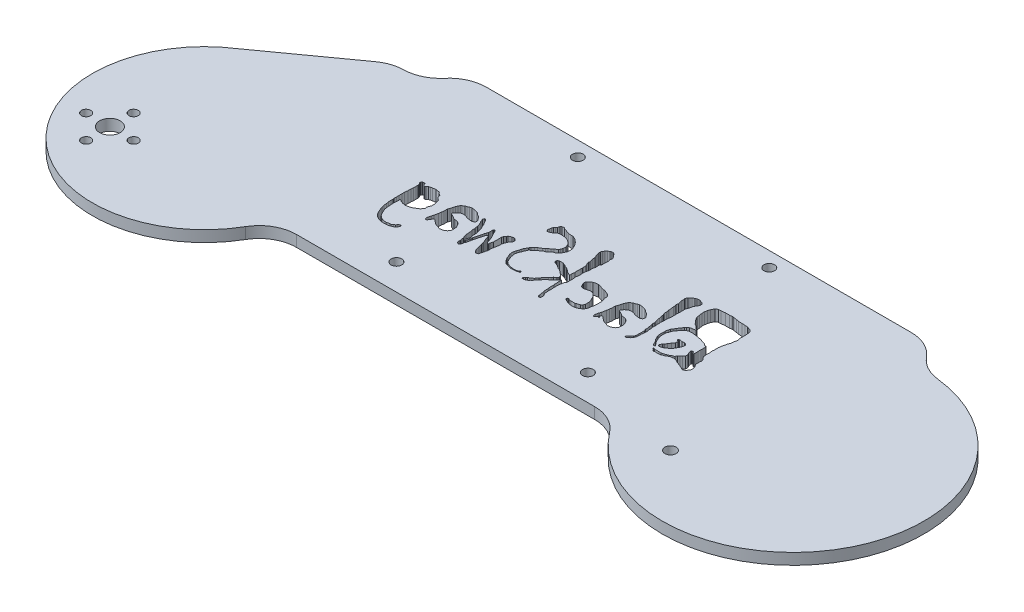
from build123d import *

# Parameters (mm, degrees)
SKETCH1_R           = 2.75
SKETCH1_R_2         = 1.5
BOSS_EXTRUDE1_DEPTH = 3
SKETCH3_R           = 1.42
CUT_EXTRUDE2_DEPTH  = 20
SKETCH5_R           = 1.25
CUT_EXTRUDE3_DEPTH  = 10
FILLET1_R           = 10
FILLET2_R           = 10
FILLET3_R           = 10
CUT_EXTRUDE4_DEPTH  = 10
CUT_EXTRUDE8_DEPTH  = 10
SKETCH12_R          = 0.638544934
SKETCH12_R_2        = 0.500762828
SKETCH12_R_3        = 0.429198386
SKETCH12_R_4        = 0.603558654
SKETCH12_R_5        = 0.236210711
SKETCH12_R_6        = 0.307421129
SKETCH12_R_7        = 0.615950929
BOSS_EXTRUDE2_DEPTH = 3


with BuildPart() as part:
    # Sketch1 → Boss-Extrude1 (new body)
    with BuildSketch(Plane(origin=(0, 0, 0), x_dir=(1, 0, 0), z_dir=(0, 1, 0))):
        with BuildLine():
            Line((-61.421696796, 42.03125), (-67.039661146, 35))
            Line((-67.039661146, 35), (-74.713671979, 35))
            Line((-74.713671979, 35), (-98.746291648, 17.720190477))
            ThreePointArc((-98.746291648, 17.720190477), (-101.110311457, -31.029902411), (-54.215728753, -17.5))
            Line((-54.215728753, -17.5), (37.189110868, -17.5))
            ThreePointArc((37.189110868, -17.5), (97.810889132, -17.5), (67.5, 35))
            Line((67.5, 35), (61.88203565, 42.03125))
            Line((61.88203565, 42.03125), (-61.421696796, 42.03125))
        make_face()
        with Locations(Location((-97.810889132, -17.5, 0), (0, 0, 270))):
            Circle(SKETCH1_R, mode=Mode.SUBTRACT)
        with Locations(Location((52.189110868, -17.5, 0), (0, 0, 270))):
            Circle(SKETCH1_R_2, mode=Mode.SUBTRACT)
    extrude(amount=BOSS_EXTRUDE1_DEPTH)

    # Sketch3 → Cut-Extrude2 (cut)
    with BuildSketch(Plane(origin=(0, 3, 0), x_dir=(1, 0, 0), z_dir=(0, 1, 0))):
        with Locations(Location((-28.142811364, -10.5, 0), (0, 0, 270))):
            Circle(SKETCH3_R)
        with Locations(Location((23.088594579, -10.5, 0), (0, 0, 270))):
            Circle(SKETCH3_R)
        with Locations(Location((-28.142811364, 38.03125, 0), (0, 0, 270))):
            Circle(SKETCH3_R)
        with Locations(Location((23.088594579, 38.03125, 0), (0, 0, 270))):
            Circle(SKETCH3_R)
    extrude(amount=-CUT_EXTRUDE2_DEPTH, mode=Mode.SUBTRACT)

    # Sketch5 → Cut-Extrude3 (cut)
    with BuildSketch(Plane(origin=(0, 3, 0), x_dir=(1, 0, 0), z_dir=(0, 1, 0))):
        with BuildLine():
            ThreePointArc((-97.810889132, -9.9), (-99.060889132, -11.15), (-97.810889132, -12.4))
            Line((-97.810889132, -12.4), (-97.810889132, -9.9))
        make_face()
        with BuildLine():
            Line((-97.810889132, -9.9), (-97.810889132, -12.4))
            ThreePointArc((-97.810889132, -12.4), (-96.927005656, -12.033883476), (-96.560889132, -11.15))
            ThreePointArc((-96.560889132, -11.15), (-96.927005656, -10.266116524), (-97.810889132, -9.9))
        make_face()
        with Locations(Location((-104.160889132, -17.5, 0), (0, 0, 270))):
            Circle(SKETCH5_R)
        with Locations(Location((-91.460889132, -17.5, 0), (0, 0, 270))):
            Circle(SKETCH5_R)
        with Locations(Location((-97.810889132, -23.85, 0), (0, 0, 270))):
            Circle(SKETCH5_R)
    extrude(amount=-CUT_EXTRUDE3_DEPTH, mode=Mode.SUBTRACT)

    # Sketch6 → Loft1 section 0
    with BuildSketch(Plane(origin=(0, 0, 0), x_dir=(-1, 0, 0), z_dir=(0, -1, 0)), mode=Mode.PRIVATE) as loft1_s0:
        with BuildLine():
            Line((-66.122147477, -2.038710992), (-57.305368693, 4.645694205))
            Line((-57.305368693, 4.645694205), (-68.36728736, 4.871119064))
            Line((-68.36728736, 4.871119064), (-72, 15.321968783))
            Line((-72, 15.321968783), (-75.63271264, 4.871119064))
            Line((-75.63271264, 4.871119064), (-86.694631307, 4.645694205))
            Line((-86.694631307, 4.645694205), (-77.877852523, -2.038710992))
            Line((-77.877852523, -2.038710992), (-81.0817816, -12.628880936))
            Line((-81.0817816, -12.628880936), (-72, -6.309220824))
            Line((-72, -6.309220824), (-62.9182184, -12.628880936))
            Line((-62.9182184, -12.628880936), (-66.122147477, -2.038710992))
        make_face()
    loft([Vertex(72, -3, 0), loft1_s0.sketch])

    # Fillet1
    fillet1_edges = [part.edges().sort_by_distance(p)[0] for p in [
        (37.189110868, 1.5, 17.5),
        (-54.215728753, 1.5, 17.5),
    ]]
    fillet(fillet1_edges, radius=FILLET1_R)

    # Fillet2
    fillet2_edges = [part.edges().sort_by_distance(p)[0] for p in [
        (-67.039661146, 1.5, -35),
        (67.5, 1.5, -35),
    ]]
    fillet(fillet2_edges, radius=FILLET2_R)

    # Fillet3
    fillet3_edges = [part.edges().sort_by_distance(p)[0] for p in [
        (61.88203565, 1.5, -42.03125),
        (-61.421696796, 1.5, -42.03125),
        (-74.713671979, 1.5, -35),
    ]]
    fillet(fillet3_edges, radius=FILLET3_R)

    # Sketch8 → Cut-Extrude4 (cut)
    # profile 1 of 20: a face of its own
    with BuildSketch(Plane.XZ):
        Polygon((32.934520943, -22.751623377), (32.95481315, -22.536525974), (33.194261202, -22.5), (33.125267696, -22.751623377), (33.011631332, -23.019480519), align=None)
    # profile 2 of 20: a face of its own
    with BuildSketch(Plane.XZ):
        Polygon((23.843611852, -8.003246753), (23.888254709, -7.459415584), (24.034358605, -7.11038961), (24.298157306, -6.651785714), (24.444261202, -6.205357143), (24.927215748, -5.775162338), (25.146371592, -5.150162338), (25.466988475, -4.63474026), (25.803839125, -4.577922078), (25.92153393, -4.6875), (25.686144319, -4.951298701), (25.657735228, -5.146103896), (25.548157306, -5.284090909), (25.27218328, -5.519480519), (24.846046917, -6.278409091), (24.651241722, -6.789772727), (24.338741722, -7.633928571), (24.363092371, -8.741883117), (24.444261202, -9.391233766), (24.618774189, -9.586038961), (24.643124839, -9.902597403), (24.82981315, -10.18262987), (24.82981315, -10.44237013), (25.27218328, -10.900974026), (25.540040423, -11.371753247), (25.76731315, -11.550324675), (25.820072891, -11.773538961), (26.221858605, -12.146915584), (26.863092371, -12.532467532), (28.040040423, -12.62987013), (29.018124839, -12.508116883), (29.740527436, -12.37012987), (30.527865099, -12.232142857), (32.17153393, -11.672077922), (32.415040423, -11.383928571), (32.800592371, -11.359577922), (32.934520943, -10.921266234), (32.962930034, -10.470779221), (32.934520943, -9.853896104), (32.962930034, -9.103084416), (33.015689774, -8.543019481), (32.962930034, -7.954545455), (32.711306657, -7.954545455), (32.557085878, -8.267045455), (32.415040423, -8.474025974), (32.074131332, -8.380681818), (31.895559904, -8.275162338), (31.919910553, -7.954545455), (32.029488475, -7.516233766), (32.289228735, -7.102272727), (32.374456008, -6.396103896), (31.895559904, -6.010551948), (31.538417047, -5.689935065), (31.221858605, -5.328733766), (31.002702761, -4.837662338), (30.633384579, -4.744318182), (30.207248215, -4.529220779), (29.72429367, -4.200487013), (29.395559904, -4.13961039), (28.941014449, -3.952922078), (28.352540423, -3.798701299), (27.731598865, -3.823051948), (26.607410553, -3.823051948), (26.181274189, -4.070616883), (26.181274189, -3.851461039), (26.303027436, -3.693181818), (26.59929367, -3.486201299), (26.785981982, -3.210227273), (26.96455341, -3.153409091), (27.179650813, -3.279220779), (28.121209254, -3.279220779), (28.835494969, -3.36038961), (28.997832631, -3.547077922), (29.497020943, -3.603896104), (29.910981982, -3.940746753), (30.276241722, -4.050324675), (30.544098865, -4.237012987), (30.787605358, -4.155844156), (31.258384579, -4.318181818), (31.948319644, -4.184253247), (32.780300163, -3.741883117), (33.831436527, -3.392857143), (34.02218328, -3.283279221), (34.789228735, -2.893668831), (35.288417047, -2.75974026), (35.678027436, -3.092532468), (36.177215748, -3.656655844), (36.311144319, -4.387175325), (36.1041638, -5.008116883), (36.15692354, -5.133928571), (35.990527436, -5.271915584), (35.860657306, -5.409902597), (35.552215748, -5.921266234), (35.653676787, -6.404220779), (35.552215748, -6.830357143), (35.678027436, -7.163149351), (35.552215748, -7.8125), (35.304650813, -8.100649351), (34.882572891, -8.612012987), (34.882572891, -9.107142857), (34.805462501, -9.45211039), (34.882572891, -10.418019481), (34.77705341, -10.693993506), (34.752702761, -11.343344156), (34.817637826, -11.635551948), (34.785170293, -12.613636364), (34.943449514, -13.774350649), (35.117962501, -14.200487013), (35.215365099, -14.849837662), (35.434520943, -15.361201299), (35.58468328, -16.546266234), (35.706436527, -16.866883117), (35.682085878, -17.305194805), (35.53192354, -17.625811688), (35.53192354, -19.460227273), (35.446696267, -20.328733766), (35.251891073, -20.70211039), (34.793287176, -21.103896104), (34.253514449, -21.213474026), (33.973481982, -21.37987013), (33.194261202, -21.461038961), (32.427215748, -21.461038961), (31.428839125, -21.50974026), (30.690202761, -21.647727273), (29.979975488, -21.749188312), (29.602540423, -21.858766234), (29.326566397, -21.777597403), (28.811144319, -21.720779221), (27.64231315, -21.720779221), (26.558709254, -21.611201299), (25.901241722, -21.582792208), (25.333059904, -21.209415584), (24.943449514, -20.474837662), (24.760819644, -19.825487013), (24.622832631, -19.147727273), (24.622832631, -18.453733766), (24.764878086, -17.694805195), (24.821696267, -16.935876623), (25.42640406, -15.965909091), (25.860657306, -15.564123377), (26.270559904, -14.967532468), (26.635819644, -14.829545455), (26.98890406, -14.472402597), (27.455624839, -14.123376623), (27.735657306, -13.98538961), (27.682897566, -13.778409091), (27.313579384, -13.668831169), (26.794098865, -13.612012987), (26.315202761, -13.474025974), (25.917475488, -13.068181818), (25.523806657, -12.849025974), (25.251891073, -12.276785714), (24.716176787, -11.566558442), (24.403676787, -10.941558442), (24.103352112, -10.535714286), (23.993774189, -10.105519481), (23.843611852, -9.423701299), (23.884196267, -8.965097403), (23.843611852, -8.518668831), align=None)
        Polygon((25.14231315, -18.080357143), (25.223481982, -18.831168831), (25.280300163, -19.094967532), (25.223481982, -19.338474026), (25.625267696, -19.983766234), (26.148806657, -20.434253247), (26.380137826, -20.434253247), (26.54653393, -20.681818182), (28.072507956, -20.681818182), (28.721858605, -20.519480519), (29.643124839, -20.300324675), (30.576566397, -20.012175325), (31.485657306, -19.655032468), (32.382572891, -19.123376623), (32.723481982, -18.944805195), (33.10903393, -18.591720779), (33.316014449, -18.084415584), (33.454001462, -17.155032468), (33.417475488, -16.623376623), (33.23890406, -15.734577922), (33.202378086, -14.955357143), (33.040040423, -14.55762987), (33.040040423, -13.916396104), (32.934520943, -13.356331169), (32.609845618, -13.218344156), (32.106598865, -13.149350649), (31.526241722, -13.214285714), (30.333059904, -13.563311688), (29.440202761, -13.640422078), (28.936956008, -13.668831169), (28.137443021, -14.038149351), (27.743774189, -14.314123377), (27.366339125, -14.545454545), (26.997020943, -14.943181818), (26.78192354, -15.024350649), (26.526241722, -15.462662338), (26.1041638, -15.779220779), (25.860657306, -16.148538961), (25.466988475, -16.396103896), (25.414228735, -17.012987013), (25.251891073, -17.353896104), (25.276241722, -17.601461039), align=None, mode=Mode.SUBTRACT)
    # profile 3 of 20: a face of its own
    with BuildSketch(Plane.XZ):
        Polygon((26.181274189, -5.458603896), (26.23403393, -5.219155844), (26.493774189, -5.097402597), (26.822507956, -5.097402597), (27.528676787, -5.381493506), (27.991339125, -5.706168831), (28.701566397, -6.132305195), (29.17640406, -6.92775974), (29.557897566, -7.650162338), (29.72429367, -8.116883117), (29.817637826, -8.571428571), (29.817637826, -8.928571429), (29.67153393, -9.099025974), (29.156111852, -9.334415584), (28.563579384, -9.253246753), (27.784358605, -9.362824675), (27.573319644, -9.224837662), (27.479975488, -9.042207792), (27.691014449, -8.843344156), (27.999456008, -8.733766234), (27.942637826, -8.056006494), (27.467800163, -7.467532468), (27.0416638, -6.879058442), (26.712930034, -6.229707792), (26.453189774, -6.107954545), align=None)
    # profile 4 of 20: a face of its own
    with BuildSketch(Plane.XZ):
        Polygon((18.908546917, -19.638798701), (18.997832631, -19.383116883), (18.997832631, -19.0625), (19.026241722, -18.563311688), (19.160170293, -18.120941558), (19.277865099, -17.512175325), (19.160170293, -17.041396104), (19.277865099, -16.627435065), (19.338741722, -16.099837662), (19.456436527, -14.809253247), (19.578189774, -14.419642857), (19.606598865, -13.989448052), (19.578189774, -13.356331169), (19.82981315, -12.909902597), (19.919098865, -12.305194805), (20.065202761, -11.647727273), (20.186956008, -10.921266234), (20.304650813, -10.422077922), (20.491339125, -10.044642857), (20.466988475, -9.760551948), (20.466988475, -9.383116883), (20.604975488, -9.021915584), (20.673968995, -8.551136364), (20.710494969, -8.173701299), (20.811956008, -7.650162338), (20.811956008, -7.203733766), (20.986468995, -6.708603896), (20.986468995, -5.49512987), (20.958059904, -5.105519481), (20.958059904, -4.728084416), (20.901241722, -4.338474026), (20.730787176, -4.030032468), (20.34929367, -3.705357143), (20.154488475, -3.449675325), (19.687767696, -3.019480519), (19.740527436, -2.75974026), (20.016501462, -2.75974026), (20.333059904, -2.893668831), (20.71455341, -3.206168831), (21.071696267, -3.733766234), (21.307085878, -4.176136364), (21.335494969, -4.61038961), (21.359845618, -5.162337662), (21.359845618, -5.580357143), (21.441014449, -6.055194805), (21.505949514, -6.525974026), (21.505949514, -7.053571429), (21.39231315, -7.581168831), (21.372020943, -8.104707792), (21.307085878, -8.482142857), (21.246209254, -8.904220779), (21.28679367, -9.346590909), (21.246209254, -9.845779221), (21.246209254, -10.385551948), (21.165040423, -10.80762987), (21.246209254, -11.25), (21.307085878, -11.806006494), (21.246209254, -12.491883117), (21.396371592, -13.262987013), (21.428839125, -14.017857143), (21.396371592, -14.655032468), (21.457248215, -16.059253247), (21.428839125, -16.63961039), (21.457248215, -17.219967532), (21.623644319, -17.743506494), (21.773806657, -18.299512987), (21.895559904, -18.87987013), (22.139066397, -19.269480519), (22.394748215, -19.63474026), (22.544910553, -20.040584416), (22.544910553, -20.539772727), (22.272994969, -20.852272727), (21.838741722, -21.038961039), (21.404488475, -21.201298701), (21.010819644, -21.201298701), (20.637443021, -21.17288961), (20.199131332, -20.986201299), (19.781111852, -20.649350649), (19.46455341, -20.434253247), (19.164228735, -20.150162338), align=None)
    # profile 5 of 20: a face of its own
    with BuildSketch(Plane.XZ):
        Polygon((18.389066397, -8.153409091), (18.624456008, -7.954545455), (18.908546917, -8.096590909), (18.742150813, -8.474025974), (18.42153393, -8.4375), align=None)
    # profile 6 of 20: a face of its own
    with BuildSketch(Plane.XZ):
        Polygon((10.580624839, -6.116071429), (10.747020943, -6.006493506), (10.89718328, -6.063311688), (10.89718328, -6.225649351), (10.637443021, -6.347402597), align=None)
    # profile 7 of 20: a face of its own
    with BuildSketch(Plane.XZ):
        Polygon((10.596858605, -3.668831169), (10.625267696, -3.482142857), (10.824131332, -3.279220779), (11.035170293, -3.279220779), (11.262443021, -3.498376623), (11.376079384, -3.831168831), (11.607410553, -4.103084416), (11.753514449, -4.476461039), (11.895559904, -4.577922078), (12.049780683, -4.500811688), (12.264878086, -4.362824675), (12.496209254, -4.082792208), (12.865527436, -3.867694805), (13.092800163, -3.640422078), (13.490527436, -3.4375), (13.936956008, -3.271103896), (14.318449514, -3.145292208), (14.663417047, -3.043831169), (14.919098865, -2.938311688), (15.186956008, -3.019480519), (15.556274189, -3.07224026), (15.990527436, -3.258928571), (16.384196267, -3.51461039), (16.627702761, -3.839285714), (16.806274189, -4.200487013), (16.830624839, -4.776785714), (16.830624839, -5.166396104), (16.753514449, -5.592532468), (16.518124839, -6.034902597), (16.290852112, -6.452922078), (15.978352112, -6.749188312), (15.653676787, -7.000811688), (15.215365099, -7.081980519), (14.825754709, -7.13474026), (14.387443021, -7.244318182), (14.010007956, -7.5), (13.522994969, -7.767857143), (13.283546917, -7.873376623), (13.035981982, -7.954545455), (12.934520943, -8.210227273), (13.145559904, -8.56737013), (13.393124839, -8.887987013), (13.9166638, -9.342532468), (14.452378086, -9.488636364), (14.882572891, -9.512987013), (15.040852112, -9.488636364), (15.316826138, -9.488636364), (15.641501462, -9.334415584), (15.929650813, -9.159902597), (16.282735228, -9.107142857), (16.67640406, -9.107142857), (17.135007956, -8.993506494), (17.540852112, -8.993506494), (17.869585878, -9.172077922), (18.104975488, -9.419642857), (18.129326138, -9.76461039), (18.048157306, -10.068993506), (17.760007956, -10.413961039), (17.455624839, -10.815746753), (17.086306657, -11.116071429), (16.672345618, -11.339285714), (16.221858605, -11.708603896), (15.795722241, -11.903409091), (15.012443021, -12.053571429), (14.342800163, -12.11038961), (13.859845618, -11.976461039), (13.462118345, -11.773538961), (13.035981982, -11.63961039), (12.557085878, -11.331168831), (12.309520943, -11.091720779), (12.061956008, -10.70211039), (11.883384579, -10.202922078), (11.745397566, -9.719967532), (11.554650813, -9.078733766), (11.376079384, -8.595779221), (11.351728735, -8.17775974), (11.376079384, -7.654220779), (11.254326138, -7.049512987), (11.185332631, -6.420454545), (10.970235228, -5.320616883), (10.836306657, -4.902597403), (10.718611852, -4.529220779), (10.621209254, -4.058441558), align=None)
        Polygon((12.646371592, -6.651785714), (12.747832631, -6.810064935), (13.096858605, -6.915584416), (13.393124839, -6.887175325), (13.660981982, -6.757305195), (13.961306657, -6.651785714), (14.269748215, -6.465097403), (14.570072891, -6.412337662), (14.833871592, -6.266233766), (15.065202761, -6.079545455), (15.207248215, -5.844155844), (15.389878086, -5.535714286), (15.434520943, -5.271915584), (15.53192354, -5.020292208), (15.53192354, -4.703733766), (15.410170293, -4.423701299), (15.08955341, -4.318181818), (14.740527436, -4.318181818), (14.354975488, -4.423701299), (14.17640406, -4.63474026), (13.936956008, -4.703733766), (13.372832631, -5.125811688), (13.096858605, -5.324675325), (12.90205341, -5.669642857), (12.699131332, -5.949675325), (12.674780683, -6.318993506), align=None, mode=Mode.SUBTRACT)
    # profile 8 of 20: a face of its own
    with BuildSketch(Plane.XZ):
        Polygon((11.635819644, -3.762175325), (11.716988475, -3.676948052), (11.895559904, -3.762175325), (11.842800163, -3.924512987), (11.716988475, -4.021915584), align=None)
    # profile 9 of 20: a face of its own
    with BuildSketch(Plane.XZ):
        Polygon((1.765689774, -9.845779221), (1.818449514, -9.460227273), (1.952378086, -9.176136364), (2.317637826, -8.51461039), (2.691014449, -8.392857143), (3.21455341, -8.392857143), (3.65692354, -8.543019481), (4.005949514, -8.595779221), (4.476728735, -8.733766234), (4.894748215, -8.733766234), (5.174780683, -8.628246753), (5.657735228, -8.356331169), (5.941826138, -8.068181818), (6.23403393, -7.690746753), (6.436956008, -7.313311688), (6.542475488, -7.000811688), (6.623644319, -6.781655844), (6.814391073, -6.623376623), (6.932085878, -6.091720779), (6.960494969, -5.698051948), (6.960494969, -4.943181818), (6.785981982, -4.541396104), (6.432897566, -4.200487013), (6.124456008, -4.070616883), (5.653676787, -3.928571429), (5.357410553, -3.798701299), (4.330624839, -3.798701299), (3.888254709, -3.859577922), (3.644748215, -3.944805195), (3.454001462, -4.058441558), (3.198319644, -4.030032468), (3.064391073, -3.798701299), (3.117150813, -3.607954545), (3.389066397, -3.388798701), (3.758384579, -3.210227273), (4.233222241, -3.019480519), (4.655300163, -2.881493506), (5.008384579, -2.828733766), (5.702378086, -2.75974026), (6.355787176, -2.828733766), (6.737280683, -2.991071429), (7.102540423, -3.153409091), (7.48403393, -3.413149351), (7.77218328, -3.518668831), (7.934520943, -3.900162338), (8.10903393, -4.241071429), (8.218611852, -4.63474026), (8.275430034, -5.137987013), (8.409358605, -5.693993506), (8.490527436, -6.306818182), (8.490527436, -6.741071429), (8.518936527, -7.325487013), (8.490527436, -7.771915584), (8.409358605, -8.246753247), (8.222670293, -8.640422078), (8.141501462, -8.912337662), (8.141501462, -9.443993506), (8.019748215, -9.837662338), (7.492150813, -10.300324675), (7.248644319, -10.422077922), (7.057897566, -10.474837662), (6.554650813, -10.665584416), (6.217800163, -10.775162338), (5.92153393, -10.799512987), (5.418287176, -10.925324675), (4.919098865, -11.112012987), (4.525430034, -11.221590909), (4.119585878, -11.331168831), (3.729975488, -11.30275974), (3.279488475, -11.217532468), (2.861468995, -11.075487013), (2.455624839, -10.746753247), (2.118774189, -10.519480519), (1.846858605, -10.219155844), align=None)
    # profile 10 of 20: a face of its own
    with BuildSketch(Plane.XZ):
        Polygon((8.778676787, -8.69724026), (8.945072891, -8.474025974), (9.115527436, -8.607954545), (9.298157306, -8.786525974), (9.079001462, -8.993506494), (8.778676787, -8.993506494), align=None)
    # profile 11 of 20: a face of its own
    with BuildSketch(Plane.XZ):
        Polygon((-7.584959577, -2.73538961), (-7.528141395, -2.528409091), (-7.325219317, -2.5), (-6.964018018, -2.5), (-6.566290746, -2.666396104), (-6.140154382, -2.897727273), (-6.03057646, -3.145292208), (-5.685608927, -3.405032468), (-5.409634901, -3.790584416), (-5.036258278, -4.131493506), (-4.524894642, -4.862012987), (-4.330089447, -5.202922078), (-3.997297239, -5.478896104), (-3.599569966, -5.767045455), (-3.278953083, -6.043019481), (-2.921810226, -6.274350649), (-2.353628408, -6.810064935), (-1.870673862, -7.333603896), (-1.801680356, -5.511363636), (-1.757037499, -5.166396104), (-1.757037499, -3.93262987), (-1.683985551, -3.559253247), (-1.627167369, -2.654220779), (-1.558173862, -2.244318182), (-1.351193343, -1.164772727), (-1.318725811, -0.80762987), (-1.168563473, -0.474837662), (-0.876355681, -0.422077922), (-0.632849187, -0.474837662), (-0.571972564, -0.762987013), (-0.571972564, -1.237824675), (-0.896647888, -1.826298701), (-1.058985551, -2.329545455), (-1.058985551, -2.792207792), (-1.132037499, -3.352272727), (-1.091453083, -3.855519481), (-1.132037499, -4.521103896), (-1.132037499, -5.284090909), (-1.091453083, -6.034902597), (-0.961582953, -6.948051948), (-0.636907629, -7.573051948), (-0.604440096, -8.214285714), (-0.604440096, -8.993506494), (-0.636907629, -9.496753247), (-0.701842694, -9.971590909), (-0.571972564, -10.478896104), (-0.571972564, -11.063311688), (-0.600381655, -11.704545455), (-0.628790746, -11.976461039), (-0.600381655, -12.508116883), (-0.429927109, -12.958603896), (-0.397459577, -13.461850649), (-0.397459577, -14.293831169), (-0.210771265, -14.931006494), (-0.304115421, -15.775162338), (0.028676787, -16.241883117), (0.004326138, -16.976461039), (0.004326138, -17.451298701), (0.057085878, -17.918019481), (-0.052492044, -18.555194805), (0.028676787, -19.11525974), (-0.133660875, -19.508928571), (-0.413693343, -19.825487013), (-0.681550486, -20.178571429), (-0.989992044, -20.543831169), (-1.363368668, -20.681818182), (-1.777329707, -20.600649351), (-2.04518685, -20.462662338), (-2.434797239, -20.227272727), (-2.767589447, -19.894480519), (-3.007037499, -19.492694805), (-3.14096607, -19.163961039), (-3.169375161, -18.790584416), (-3.043563473, -18.388798701), (-2.946160875, -18.003246753), (-2.795998538, -17.491883117), (-2.580901135, -17.033279221), (-2.556550486, -16.550324675), (-2.430738798, -16.124188312), (-2.308985551, -15.499188312), (-2.35768685, -15.056818182), (-2.183173862, -14.492694805), (-1.895024512, -14.00974026), (-1.895024512, -13.303571429), (-1.842264772, -13.039772727), (-1.870673862, -12.613636364), (-1.870673862, -11.205357143), (-1.842264772, -10.803571429), (-1.927492044, -10.154220779), (-1.870673862, -9.50487013), (-2.90557646, -10.068993506), (-3.299245291, -10.466720779), (-3.591453083, -10.576298701), (-3.871485551, -10.795454545), (-4.630414122, -11.112012987), (-4.882037499, -11.331168831), (-5.162069966, -11.359577922), (-5.454277759, -11.50974026), (-5.803303733, -11.5625), (-6.196972564, -11.590909091), (-6.517589447, -11.558441558), (-6.797621914, -11.424512987), (-7.008660875, -11.176948052), (-7.065479057, -10.965909091), (-6.935608927, -10.706168831), (-6.736745291, -10.551948052), (-6.326842694, -10.418019481), (-5.925056979, -10.227272727), (-5.543563473, -10.05275974), (-5.283823213, -9.809253247), (-4.902329707, -9.577922078), (-4.618238798, -9.553571429), (-4.317914122, -9.310064935), (-3.932362174, -9.066558442), (-3.563043992, -8.754058442), (-3.149082953, -8.388798701), (-2.950219317, -8.120941558), (-2.836582953, -7.901785714), (-2.836582953, -7.674512987), (-3.027329707, -7.402597403), (-3.214018018, -7.252435065), (-3.60768685, -6.956168831), (-3.879602434, -6.566558442), (-4.244862174, -6.241883117), (-5.137719317, -5.186688312), (-5.32846607, -4.821428571), (-5.693725811, -4.443993506), (-5.961582953, -4.078733766), (-6.274082953, -3.916396104), (-6.639342694, -3.628246753), (-7.0208362, -3.433441558), (-7.20346607, -3.145292208), (-7.479440096, -2.897727273), align=None)
    # profile 12 of 20: a face of its own
    with BuildSketch(Plane.XZ):
        Polygon((-15.377167369, -16.408279221), (-15.344699837, -16.06737013), (-14.934797239, -15.978084416), (-14.658823213, -16.006493506), (-14.33820633, -16.286525974), (-14.630414122, -16.525974026), (-15.072784252, -16.554383117), align=None)
    # profile 13 of 20: a face of its own
    with BuildSketch(Plane.XZ):
        Polygon((-15.377167369, -17.122564935), (-15.121485551, -16.785714286), (-14.776518018, -16.785714286), (-14.362556979, -16.935876623), (-13.97294659, -17.126623377), (-13.575219317, -17.426948052), (-13.494050486, -17.686688312), (-12.998920616, -17.796266234), (-12.718888148, -17.905844156), (-12.170998538, -17.824675325), (-11.704277759, -17.824675325), (-11.221323213, -17.796266234), (-10.555738798, -17.548701299), (-10.072784252, -17.260551948), (-9.297621914, -16.530032468), (-9.139342694, -16.132305195), (-8.883660875, -15.568181818), (-8.94859594, -14.92288961), (-9.163693343, -14.383116883), (-9.374732304, -14.054383117), (-10.068725811, -13.543019481), (-10.466453083, -13.20211039), (-10.933173862, -12.897727273), (-11.29031672, -12.55275974), (-11.716453083, -12.224025974), (-12.597134901, -11.688311688), (-13.03544659, -11.286525974), (-13.356063473, -10.917207792), (-13.66044659, -10.698051948), (-13.741615421, -10.381493506), (-14.179927109, -9.650974026), (-14.366615421, -9.196428571), (-14.472134901, -8.701298701), (-14.670998538, -8.165584416), (-14.829277759, -7.654220779), (-14.85768685, -6.92775974), (-14.752167369, -6.363636364), (-14.443725811, -5.70211039), (-14.28544659, -5.178571429), (-13.94859594, -4.805194805), (-13.79031672, -4.464285714), (-13.40070633, -4.050324675), (-13.055738798, -3.762175325), (-12.479440096, -3.538961039), (-11.7083362, -3.405032468), (-11.172621914, -3.279220779), (-10.559797239, -3.372564935), (-10.129602434, -3.396915584), (-9.744050486, -3.457792208), (-9.451842694, -3.583603896), (-9.248920616, -3.583603896), (-9.143401135, -3.689123377), (-9.196160875, -3.93262987), (-9.301680356, -4.058441558), (-9.496485551, -4.058441558), (-9.496485551, -3.920454545), (-9.54518685, -3.82711039), (-9.72781672, -3.725649351), (-10.105251785, -3.583603896), (-10.95346607, -3.538961039), (-11.225381655, -3.62012987), (-11.643401135, -3.595779221), (-12.20346607, -3.762175325), (-12.710771265, -3.997564935), (-13.335771265, -4.45211039), (-13.441290746, -4.784902597), (-13.701031005, -5.239448052), (-13.855251785, -5.726461039), (-14.054115421, -6.083603896), (-14.07846607, -6.513798701), (-14.216453083, -7.138798701), (-14.106875161, -7.540584416), (-13.997297239, -8.080357143), (-13.721323213, -8.494318182), (-13.591453083, -9.005681818), (-13.352005031, -9.488636364), (-13.181550486, -9.94724026), (-12.864992044, -10.142045455), (-12.613368668, -10.430194805), (-12.244050486, -10.710227273), (-11.91531672, -11.055194805), (-11.318725811, -11.331168831), (-10.965641395, -11.704545455), (-10.567914122, -11.789772727), (-10.186420616, -12.13474026), (-9.695349187, -12.491883117), (-9.431550486, -12.727272727), (-8.944537499, -12.869318182), (-8.481875161, -13.295454545), (-8.071972564, -13.794642857), (-7.836582953, -14.306006494), (-7.584959577, -14.845779221), (-7.584959577, -15.925324675), (-7.812232304, -16.521915584), (-8.084147888, -17.090097403), (-8.392589447, -17.573051948), (-8.745673862, -17.962662338), (-9.082524512, -18.279220779), (-9.500543992, -18.624188312), (-9.995673862, -18.875811688), (-10.429927109, -19.042207792), (-11.063043992, -19.066558442), (-11.667751785, -19.123376623), (-12.276518018, -19.269480519), (-12.800056979, -19.541396104), (-13.352005031, -19.699675325), (-13.60768685, -19.902597403), (-14.135284252, -19.821428571), (-14.431550486, -19.541396104), (-14.606063473, -19.042207792), (-14.825219317, -18.774350649), (-15.09307646, -18.49025974), (-15.267589447, -18.060064935), (-15.324407629, -17.646103896), align=None)
    # profile 14 of 20: a face of its own
    with BuildSketch(Plane.XZ):
        Polygon((-24.72781672, -10.231331169), (-24.634472564, -10.101461039), (-24.46807646, -10.206980519), (-24.46807646, -10.308441558), (-24.634472564, -10.361201299), align=None)
    # profile 15 of 20: a face of its own
    with BuildSketch(Plane.XZ):
        Polygon((-26.545998538, -10.957792208), (-26.464829707, -10.734577922), (-26.355251785, -10.515422078), (-26.221323213, -10.113636364), (-25.961582953, -9.797077922), (-25.852005031, -9.521103896), (-25.71807646, -9.090909091), (-25.555738798, -8.607954545), (-25.527329707, -8.137175325), (-25.40557646, -7.73538961), (-25.40557646, -7.305194805), (-25.377167369, -7.05762987), (-25.295998538, -6.712662338), (-25.243238798, -6.282467532), (-25.186420616, -5.75487013), (-25.162069966, -5.300324675), (-25.105251785, -4.898538961), (-24.942914122, -4.468344156), (-24.739992044, -4.082792208), (-24.711582953, -3.709415584), (-24.711582953, -3.376623377), (-24.602005031, -3.003246753), (-24.602005031, -2.601461039), (-24.549245291, -2.353896104), (-24.46807646, -2.118506494), (-24.114992044, -1.980519481), (-23.871485551, -1.980519481), (-23.688855681, -2.215909091), (-23.595511525, -2.658279221), (-23.567102434, -3.003246753), (-23.380414122, -3.198051948), (-23.356063473, -3.433441558), (-23.274894642, -3.737824675), (-23.14096607, -4.306006494), (-23.08820633, -4.679383117), (-23.023271265, -4.955357143), (-22.942102434, -5.271915584), (-22.860933603, -5.604707792), (-22.783823213, -5.840097403), (-22.783823213, -6.116071429), (-22.649894642, -6.351461039), (-22.568725811, -6.574675325), (-22.451031005, -6.976461039), (-22.422621914, -7.252435065), (-22.317102434, -7.516233766), (-22.154764772, -7.763798701), (-21.996485551, -7.901785714), (-21.813855681, -7.739448052), (-21.728628408, -7.455357143), (-21.614992044, -7.155032468), (-21.586582953, -6.899350649), (-21.529764772, -6.708603896), (-21.359310226, -6.493506494), (-21.205089447, -6.099837662), (-21.063043992, -5.775162338), (-20.920998538, -5.381493506), (-20.892589447, -4.987824675), (-20.750543992, -4.638798701), (-20.653141395, -4.24512987), (-20.539505031, -3.823051948), (-20.454277759, -3.376623377), (-20.312232304, -3.051948052), (-20.194537499, -2.686688312), (-20.007849187, -2.443181818), (-19.715641395, -2.24025974), (-19.541128408, -2.211850649), (-19.293563473, -2.211850649), (-19.090641395, -2.333603896), (-19.058173862, -2.524350649), (-18.944537499, -2.820616883), (-18.855251785, -3.153409091), (-18.753790746, -3.465909091), (-18.696972564, -3.948863636), (-18.558985551, -4.232954545), (-18.558985551, -4.529220779), (-18.53057646, -4.943181818), (-18.53057646, -5.308441558), (-18.473758278, -5.657467532), (-18.331712824, -6.465097403), (-18.234310226, -6.814123377), (-18.205901135, -7.179383117), (-18.234310226, -7.516233766), (-18.173433603, -7.918019481), (-18.084147888, -8.283279221), (-17.933985551, -8.551136364), (-17.844699837, -8.859577922), (-17.72294659, -9.103084416), (-17.528141395, -9.249188312), (-17.317102434, -9.464285714), (-17.195349187, -9.736201299), (-17.195349187, -10.206980519), (-17.406388148, -10.487012987), (-17.589018018, -10.67775974), (-17.994862174, -10.811688312), (-18.465641395, -10.758928571), (-18.855251785, -10.568181818), (-19.143401135, -10.405844156), (-19.386907629, -10.150162338), (-19.476193343, -9.935064935), (-19.670998538, -9.675324675), (-19.792751785, -9.326298701), (-19.792751785, -8.93262987), (-19.792751785, -8.543019481), (-19.792751785, -8.084415584), (-19.792751785, -7.637987013), (-19.792751785, -7.11038961), (-19.877979057, -6.801948052), (-19.967264772, -6.530032468), (-20.052492044, -6.221590909), (-20.052492044, -5.978084416), (-20.036258278, -5.868506494), (-20.218888148, -5.949675325), (-20.389342694, -6.063311688), (-20.531388148, -6.351461039), (-20.616615421, -6.655844156), (-20.742427109, -7.029220779), (-21.054927109, -7.844967532), (-21.282199837, -8.275162338), (-21.493238798, -8.579545455), (-21.720511525, -9.00974026), (-21.89096607, -9.411525974), (-21.988368668, -9.659090909), (-22.130414122, -9.894480519), (-22.231875161, -10.032467532), (-22.524082953, -10.004058442), (-22.649894642, -9.797077922), (-22.649894642, -9.521103896), (-22.621485551, -9.204545455), (-22.621485551, -8.924512987), (-22.649894642, -8.579545455), (-22.763531005, -8.275162338), (-22.929927109, -7.849025974), (-22.986745291, -7.418831169), (-23.14096607, -6.976461039), (-23.250543992, -6.436688312), (-23.364180356, -5.978084416), (-23.473758278, -5.551948052), (-23.587394642, -5.275974026), (-23.587394642, -4.926948052), (-23.684797239, -4.569805195), (-23.741615421, -4.249188312), (-23.826842694, -4.001623377), (-23.879602434, -3.709415584), (-23.993238798, -3.628246753), (-24.147459577, -3.875811688), (-24.147459577, -4.13961039), (-24.094699837, -4.443993506), (-23.936420616, -4.760551948), (-23.908011525, -5.064935065), (-23.936420616, -5.385551948), (-24.045998538, -5.840097403), (-24.070349187, -6.201298701), (-24.070349187, -6.603084416), (-24.094699837, -7.029220779), (-24.200219317, -7.443181818), (-24.39096607, -7.844967532), (-24.46807646, -8.275162338), (-24.5208362, -8.607954545), (-24.699407629, -8.924512987), (-24.869862174, -9.200487013), (-25.048433603, -9.602272727), (-25.202654382, -9.975649351), (-25.397459577, -10.223214286), (-25.600381655, -10.543831169), (-25.705901135, -10.819805195), (-25.896647888, -11.055194805), (-26.026518018, -11.331168831), (-26.347134901, -11.359577922), (-26.387719317, -11.25), align=None)
    # profile 16 of 20: a face of its own
    with BuildSketch(Plane.XZ):
        Polygon((-34.354440096, -6.116071429), (-34.188043992, -6.006493506), (-34.037881655, -6.063311688), (-34.037881655, -6.225649351), (-34.297621914, -6.347402597), align=None)
    # profile 17 of 20: a face of its own
    with BuildSketch(Plane.XZ):
        Polygon((-34.33820633, -3.668831169), (-34.309797239, -3.482142857), (-34.110933603, -3.279220779), (-33.899894642, -3.279220779), (-33.672621914, -3.498376623), (-33.558985551, -3.831168831), (-33.327654382, -4.103084416), (-33.181550486, -4.476461039), (-33.039505031, -4.577922078), (-32.885284252, -4.500811688), (-32.67018685, -4.362824675), (-32.438855681, -4.082792208), (-32.069537499, -3.867694805), (-31.842264772, -3.640422078), (-31.444537499, -3.4375), (-30.998108927, -3.271103896), (-30.616615421, -3.145292208), (-30.271647888, -3.043831169), (-30.01596607, -2.938311688), (-29.748108927, -3.019480519), (-29.378790746, -3.07224026), (-28.944537499, -3.258928571), (-28.550868668, -3.51461039), (-28.307362174, -3.839285714), (-28.128790746, -4.200487013), (-28.104440096, -4.776785714), (-28.104440096, -5.166396104), (-28.181550486, -5.592532468), (-28.416940096, -6.034902597), (-28.644212824, -6.452922078), (-28.956712824, -6.749188312), (-29.281388148, -7.000811688), (-29.719699837, -7.081980519), (-30.109310226, -7.13474026), (-30.547621914, -7.244318182), (-30.925056979, -7.5), (-31.412069966, -7.767857143), (-31.651518018, -7.873376623), (-31.899082953, -7.954545455), (-32.000543992, -8.210227273), (-31.789505031, -8.56737013), (-31.541940096, -8.887987013), (-31.018401135, -9.342532468), (-30.48268685, -9.488636364), (-30.052492044, -9.512987013), (-29.894212824, -9.488636364), (-29.618238798, -9.488636364), (-29.293563473, -9.334415584), (-29.005414122, -9.159902597), (-28.652329707, -9.107142857), (-28.258660875, -9.107142857), (-27.800056979, -8.993506494), (-27.394212824, -8.993506494), (-27.065479057, -9.172077922), (-26.830089447, -9.419642857), (-26.805738798, -9.76461039), (-26.886907629, -10.068993506), (-27.175056979, -10.413961039), (-27.479440096, -10.815746753), (-27.848758278, -11.116071429), (-28.262719317, -11.339285714), (-28.71320633, -11.708603896), (-29.139342694, -11.903409091), (-29.922621914, -12.053571429), (-30.592264772, -12.11038961), (-31.075219317, -11.976461039), (-31.47294659, -11.773538961), (-31.899082953, -11.63961039), (-32.377979057, -11.331168831), (-32.625543992, -11.091720779), (-32.873108927, -10.70211039), (-33.051680356, -10.202922078), (-33.189667369, -9.719967532), (-33.380414122, -9.078733766), (-33.558985551, -8.595779221), (-33.5833362, -8.17775974), (-33.558985551, -7.654220779), (-33.680738798, -7.049512987), (-33.749732304, -6.420454545), (-33.964829707, -5.320616883), (-34.098758278, -4.902597403), (-34.216453083, -4.529220779), (-34.313855681, -4.058441558), align=None)
        Polygon((-32.288693343, -6.651785714), (-32.187232304, -6.810064935), (-31.83820633, -6.915584416), (-31.541940096, -6.887175325), (-31.274082953, -6.757305195), (-30.973758278, -6.651785714), (-30.66531672, -6.465097403), (-30.364992044, -6.412337662), (-30.101193343, -6.266233766), (-29.869862174, -6.079545455), (-29.72781672, -5.844155844), (-29.54518685, -5.535714286), (-29.500543992, -5.271915584), (-29.403141395, -5.020292208), (-29.403141395, -4.703733766), (-29.524894642, -4.423701299), (-29.845511525, -4.318181818), (-30.194537499, -4.318181818), (-30.580089447, -4.423701299), (-30.758660875, -4.63474026), (-30.998108927, -4.703733766), (-31.562232304, -5.125811688), (-31.83820633, -5.324675325), (-32.033011525, -5.669642857), (-32.235933603, -5.949675325), (-32.260284252, -6.318993506), align=None, mode=Mode.SUBTRACT)
    # profile 18 of 20: a face of its own
    with BuildSketch(Plane.XZ):
        Polygon((-33.299245291, -3.762175325), (-33.21807646, -3.676948052), (-33.039505031, -3.762175325), (-33.092264772, -3.924512987), (-33.21807646, -4.021915584), align=None)
    # profile 19 of 20: a face of its own
    with BuildSketch(Plane.XZ):
        Polygon((-43.429115421, -11.034902597), (-43.278953083, -10.775162338), (-43.116615421, -10.556006494), (-43.007037499, -10.162337662), (-43.03544659, -9.602272727), (-43.03544659, -8.993506494), (-43.116615421, -8.352272727), (-43.116615421, -7.520292208), (-43.222134901, -6.732954545), (-43.169375161, -6.038961039), (-43.222134901, -5.23538961), (-43.169375161, -4.598214286), (-43.226193343, -3.969155844), (-43.116615421, -3.587662338), (-43.169375161, -3.084415584), (-43.116615421, -2.390422078), (-43.031388148, -1.781655844), (-42.978628408, -1.018668831), (-42.840641395, -0.515422078), (-42.690479057, -0.05275974), (-42.442914122, 0.588474026), (-42.130414122, 1.323051948), (-41.830089447, 1.854707792), (-41.21320633, 2.467532468), (-40.843888148, 2.739448052), (-40.259472564, 2.970779221), (-39.670998538, 3.161525974), (-38.891777759, 3.214285714), (-38.193725811, 3.161525974), (-37.605251785, 3.112824675), (-37.07359594, 2.893668831), (-36.647459577, 2.73538961), (-36.278141395, 2.414772727), (-36.034634901, 2.130681818), (-35.896647888, 1.757305195), (-35.896647888, 1.448863636), (-36.172621914, 1.396103896), (-36.416128408, 1.521915584), (-36.619050486, 1.696428571), (-36.858498538, 2.008928571), (-37.195349187, 2.207792208), (-37.568725811, 2.471590909), (-38.039505031, 2.520292208), (-38.696972564, 2.694805195), (-39.395024512, 2.613636364), (-39.971323213, 2.475649351), (-40.401518018, 2.24025974), (-40.868238798, 1.854707792), (-41.176680356, 1.400162338), (-41.501355681, 0.864448052), (-41.700219317, 0.353084416), (-41.96807646, -0.267857143), (-42.049245291, -0.913149351), (-42.130414122, -1.700487013), (-42.183173862, -2.471590909), (-42.183173862, -2.978896104), (-42.130414122, -3.474025974), (-42.102005031, -3.818993506), (-42.130414122, -4.577922078), (-41.558173862, -4.163961039), (-40.872297239, -3.924512987), (-40.076842694, -3.798701299), (-39.447784252, -3.904220779), (-38.79031672, -4.082792208), (-38.108498538, -4.456168831), (-37.702654382, -4.74025974), (-37.239992044, -4.979707792), (-36.959959577, -5.426136364), (-36.696160875, -5.840097403), (-36.781388148, -6.339285714), (-36.639342694, -6.631493506), (-36.416128408, -7.211850649), (-36.416128408, -7.398538961), (-36.444537499, -8.230519481), (-36.639342694, -8.916396104), (-36.809797239, -9.415584416), (-37.300868668, -9.776785714), (-37.625543992, -10.178571429), (-37.706712824, -10.706168831), (-38.116615421, -10.957792208), (-38.368238798, -11.12012987), (-38.534634901, -11.387987013), (-39.687232304, -11.590909091), (-40.429927109, -11.465097403), (-40.896647888, -11.383928571), (-41.302492044, -11.225649351), (-41.582524512, -11.002435065), (-41.850381655, -10.811688312), (-42.130414122, -10.848214286), (-42.38609594, -11.152597403), (-42.491615421, -11.497564935), (-42.85281672, -11.590909091), (-43.173433603, -11.497564935), (-43.364180356, -11.278409091), align=None)
        Polygon((-42.130414122, -5.791396104), (-42.04518685, -6.217532468), (-42.04518685, -6.680194805), (-42.07359594, -7.171266234), (-42.016777759, -8.125), (-41.927492044, -8.664772727), (-41.78544659, -9.001623377), (-41.481063473, -9.253246753), (-41.10768685, -9.176136364), (-40.685608927, -8.956980519), (-40.267589447, -8.725649351), (-39.821160875, -8.348214286), (-39.200219317, -8.116883117), (-38.494050486, -7.13474026), (-38.465641395, -6.607142857), (-38.384472564, -6.181006494), (-38.579277759, -5.819805195), (-38.940479057, -5.519480519), (-39.330089447, -5.016233766), (-40.007849187, -4.679383117), (-40.543563473, -4.577922078), (-41.221323213, -4.630681818), (-41.899082953, -4.837662338), (-42.07359594, -5.300324675), align=None, mode=Mode.SUBTRACT)
    # profile 20 of 20: a face of its own
    with BuildSketch(Plane.XZ):
        Polygon((-38.002979057, -2.857142857), (-37.974569966, -2.637987013), (-37.771647888, -2.5), (-37.373920616, -2.5), (-37.195349187, -2.743506494), (-37.564667369, -2.857142857), (-37.771647888, -3.019480519), align=None)
    extrude(amount=-CUT_EXTRUDE4_DEPTH, mode=Mode.SUBTRACT)


with BuildPart() as cut_extrude4_piece_1:
    # of the separate pieces the step leaves, piece 1, a body of its own (cut_extrude4_pieces)
    add(part.part.solids().sort_by_distance((64.805019755, 0, -38.37429318))[0])

    # Sketch12 → Boss-Extrude2 (add)
    with BuildSketch(Plane(origin=(0, 0, 0), x_dir=(-1, 0, 0), z_dir=(0, -1, 0))):
        with Locations((-33.125267696, 22.751623377)):
            Circle(SKETCH12_R)
        with Locations((-18.628541849, 8.20687332)):
            Circle(SKETCH12_R_2)
        with Locations((-10.60903393, 6.231737013)):
            Circle(SKETCH12_R_3)
        with Locations((-8.96919948, 8.71261769)):
            Circle(SKETCH12_R_4)
        with Locations((33.159501198, 3.79308281)):
            Circle(SKETCH12_R_5)
        with Locations((34.245622619, 6.044411139)):
            Circle(SKETCH12_R_6)
        with Locations((37.575704284, 2.764464079)):
            Circle(SKETCH12_R_7)
        Polygon((13.980796209, 16.468052639), (14.196670735, 15.460638183), (16.0132929, 15.849914361), (15.797418374, 16.857328817), align=None)
        Polygon((24.030954708, 10.18370532), (24.630606169, 9.799928384), (25.110327339, 10.18370532), (24.565083278, 10.865260396), align=None)
    extrude(amount=-BOSS_EXTRUDE2_DEPTH)


with BuildPart() as cut_extrude4_piece_2:
    # of the separate pieces the step leaves, piece 2, a body of its own (cut_extrude4_pieces)
    add(part.part.solids().sort_by_distance((25.14231315, 0, -18.080357143))[0])


with BuildPart() as cut_extrude4_piece_3:
    # of the separate pieces the step leaves, piece 3, a body of its own (cut_extrude4_pieces)
    add(part.part.solids().sort_by_distance((-42.130414122, 0, -5.791396104))[0])


with BuildPart() as cut_extrude4_piece_4:
    # of the separate pieces the step leaves, piece 4, a body of its own (cut_extrude4_pieces)
    add(part.part.solids().sort_by_distance((12.646371592, 0, -6.651785714))[0])


with BuildPart() as cut_extrude4_piece_5:
    # of the separate pieces the step leaves, piece 5, a body of its own (cut_extrude4_pieces)
    add(part.part.solids().sort_by_distance((-32.288693343, 0, -6.651785714))[0])


with BuildPart() as cut_extrude8_tool:
    # Sketch11 → Cut-Extrude8 (new body)
    with BuildSketch(Plane(origin=(0, 0, 0), x_dir=(-1, 0, 0), z_dir=(0, -1, 0))):
        Polygon((-33.443996798, 19.039676818), (-29.032577973, 20.988908392), (-26.16002618, 20.988908392), (-24.963129599, 19.792011812), (-24.963129599, 18.526721141), (-25.16831187, 16.680080703), (-26.453189774, 14.898538961), (-26.802419733, 14.857931543), (-27.459630424, 14.319785964), (-29.032577973, 13.031805135), (-33.443996798, 12.508041194), (-34.385832745, 16.956976786), align=None)
        Polygon((-14.533030827, 6.762937608), (-12.124668969, 7.272785801), (-12.124668969, 5.91867714), (-13.511327534, 3.996011875), (-15.969306724, 3.996011875), (-15.969306724, 4.957344507), (-15.37000324, 6.282595883), align=None)
        Polygon((37.831226411, 8.080712292), (38.796560764, 4.581375261), (40.526118147, 4.259597143), (42.130414122, 4.577922078), (42.5866907, 7.030408683), (42.358552411, 10.172270058), (38.796560764, 9.465498504), align=None)
        Polygon((32.763221056, 7.272785801), (32.521887467, 4.957344507), (30.690729017, 3.471871587), (29.022550436, 4.214608047), (29.022550436, 5.91867714), (29.856639727, 6.59530731), align=None)
    extrude(amount=-CUT_EXTRUDE8_DEPTH)


with BuildPart() as cut_extrude4_piece_2_1:
    add(cut_extrude4_piece_2.part)

    # Cut-Extrude8: cut by cut_extrude8_tool
    add(cut_extrude8_tool.part, mode=Mode.SUBTRACT)


with BuildPart() as cut_extrude4_piece_3_1:
    add(cut_extrude4_piece_3.part)

    # Cut-Extrude8: cut by cut_extrude8_tool
    add(cut_extrude8_tool.part, mode=Mode.SUBTRACT)


with BuildPart() as cut_extrude4_piece_4_1:
    add(cut_extrude4_piece_4.part)

    # Cut-Extrude8: cut by cut_extrude8_tool
    add(cut_extrude8_tool.part, mode=Mode.SUBTRACT)


with BuildPart() as cut_extrude4_piece_5_1:
    add(cut_extrude4_piece_5.part)

    # Cut-Extrude8: cut by cut_extrude8_tool
    add(cut_extrude8_tool.part, mode=Mode.SUBTRACT)


solid = cut_extrude4_piece_1.part
